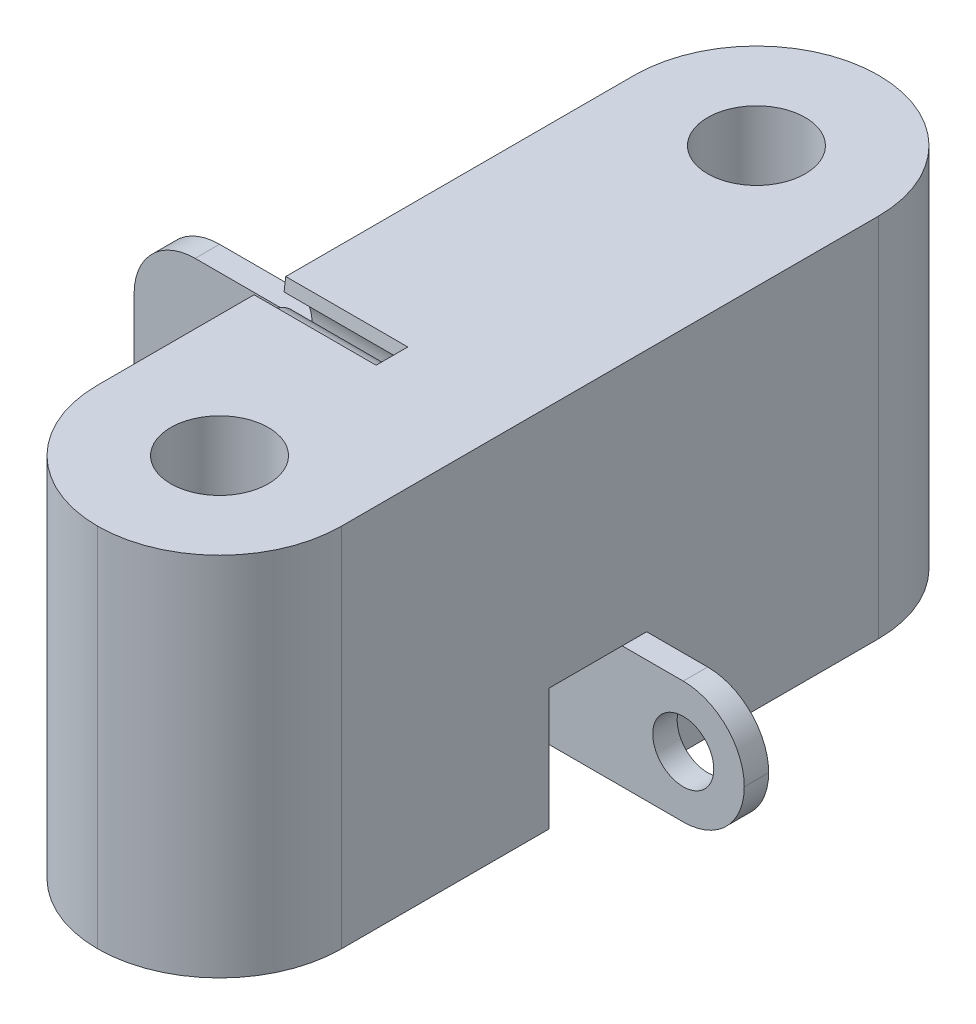
from build123d import *

# Parameters (mm, degrees)
SKETCH2_W                = 20
SKETCH2_H                = 64
BOSS_EXTRUDE1_DEPTH      = 30
SKETCH3_R                = 4
CUT_EXTRUDE1_DEPTH       = 20
SKETCH4_R                = 2.5
CUT_EXTRUDE2_DEPTH       = 10
FILLET1_R                = 10
BOSS_EXTRUDE2_DEPTH      = 20
BOSS_EXTRUDE2_DEPTH_BACK = 30
SKETCH5_W                = 2
SKETCH5_H                = 30
CUT_EXTRUDE3_REACH       = 55.161
SKETCH6_R                = 2.5
SKETCH6_W                = 10
SKETCH6_H                = 20
SKETCH6_W_2              = 20
SKETCH6_H_2              = 10
FILLET2_R                = 5
SKETCH7_W                = 21
SKETCH7_H                = 6
CUT_EXTRUDE4_DEPTH       = 10


with BuildPart() as part:
    # Sketch2 → Boss-Extrude1 (new body)
    with BuildSketch(Plane(origin=(0, 0, 0), x_dir=(1, 0, 0), z_dir=(0, 1, 0))):
        with Locations((6.47761194, -8.23880597)):
            Rectangle(SKETCH2_W, SKETCH2_H)
    extrude(amount=BOSS_EXTRUDE1_DEPTH)

    # Sketch3 → Cut-Extrude1 (cut)
    with BuildSketch(Plane(origin=(0, 30, 0), x_dir=(1, 0, 0), z_dir=(0, 1, 0))):
        with Locations(Location((6.47761194, 13.76119403, 0), (0, 0, 270))):
            Circle(SKETCH3_R)
        with Locations(Location((6.47761194, -30.23880597, 0), (0, 0, 270))):
            Circle(SKETCH3_R)
    extrude(amount=-CUT_EXTRUDE1_DEPTH, mode=Mode.SUBTRACT)

    # Sketch4 → Cut-Extrude2 (cut)
    with BuildSketch(Plane.ZY.offset(3.52238806)):
        with BuildLine():
            Line((17.415034126, 30.126407987), (14.795699792, 30.126407987))
            Line((14.795699792, 30.126407987), (14.949961333, 28.969446425))
            ThreePointArc((14.949961333, 28.969446425), (16.17927412, 22.186618473), (17.347611009, 28.980215007))
            Line((17.347611009, 28.980215007), (17.415034126, 30.126407987))
        make_face()
        with Locations((16.163554702, 25.686583173)):
            Circle(SKETCH4_R, mode=Mode.SUBTRACT)
    extrude(amount=-CUT_EXTRUDE2_DEPTH, mode=Mode.SUBTRACT)

    # Fillet1
    fillet1_edges = [part.edges().sort_by_distance(p)[0] for p in [
        (-3.52238806, 15, -23.76119403),
        (16.47761194, 15, -23.76119403),
        (16.47761194, 15, 40.23880597),
        (-3.52238806, 15, 40.23880597),
    ]]
    fillet(fillet1_edges, radius=FILLET1_R - 0.0001)  # a hair under: the kernel refuses the full size

    # Sketch5 → Boss-Extrude2 (add, two sides: drawn at the far end of the back side and taken through both)
    with BuildSketch(Plane.ZY.offset(3.52238806).offset(-BOSS_EXTRUDE2_DEPTH_BACK)):
        with Locations((6.23880597, 15)):
            Rectangle(SKETCH5_W, SKETCH5_H)
    extrude(amount=BOSS_EXTRUDE2_DEPTH + BOSS_EXTRUDE2_DEPTH_BACK)

    # Sketch6 → Cut-Extrude3 (cut, up to next)
    with BuildSketch(Plane(origin=(0, 0, 5.23880597), x_dir=(-1, 0, 0), z_dir=(0, 0, -1)), mode=Mode.PRIVATE) as cut_extrude3_sk1:
        with Locations((-21.47761194, 5)):
            Circle(SKETCH6_R)
    cut_extrude3_tool1 = extrude(cut_extrude3_sk1.sketch, amount=-CUT_EXTRUDE3_REACH, mode=Mode.PRIVATE) & part.part
    # Sketch6 → Cut-Extrude3 (cut, up to next)
    with BuildSketch(Plane(origin=(0, 0, 5.23880597), x_dir=(-1, 0, 0), z_dir=(0, 0, -1)), mode=Mode.PRIVATE) as cut_extrude3_sk2:
        with Locations((13.52238806, 5)):
            Circle(SKETCH6_R)
    cut_extrude3_tool2 = extrude(cut_extrude3_sk2.sketch, amount=-CUT_EXTRUDE3_REACH, mode=Mode.PRIVATE) & part.part
    # Sketch6 → Cut-Extrude3 (cut, up to next)
    with BuildSketch(Plane(origin=(0, 0, 5.23880597), x_dir=(-1, 0, 0), z_dir=(0, 0, -1)), mode=Mode.PRIVATE) as cut_extrude3_sk3:
        with Locations((-21.47761194, 20)):
            Rectangle(SKETCH6_W, SKETCH6_H)
    cut_extrude3_tool3 = extrude(cut_extrude3_sk3.sketch, amount=-CUT_EXTRUDE3_REACH, mode=Mode.PRIVATE) & part.part
    # Sketch6 → Cut-Extrude3 (cut, up to next)
    with BuildSketch(Plane(origin=(0, 0, 5.23880597), x_dir=(-1, 0, 0), z_dir=(0, 0, -1)), mode=Mode.PRIVATE) as cut_extrude3_sk4:
        with Locations((13.52238806, 25)):
            Rectangle(SKETCH6_W_2, SKETCH6_H_2)
    cut_extrude3_tool4 = extrude(cut_extrude3_sk4.sketch, amount=-CUT_EXTRUDE3_REACH, mode=Mode.PRIVATE) & part.part
    add(cut_extrude3_tool1.solids().sort_by_distance((21.477612, 5, 5.238806))[0], mode=Mode.SUBTRACT)
    add(cut_extrude3_tool2.solids().sort_by_distance((-13.522388, 5, 5.238806))[0], mode=Mode.SUBTRACT)
    add(cut_extrude3_tool3.solids().sort_by_distance((21.477612, 20, 5.238806))[0], mode=Mode.SUBTRACT)
    add(cut_extrude3_tool4.solids().sort_by_distance((-13.522388, 25, 5.238806))[0], mode=Mode.SUBTRACT)

    # Fillet2
    fillet2_edges = [part.edges().sort_by_distance(p)[0] for p in [
        (-23.52238806, 20, 6.23880597),
        (-23.52238806, 0, 6.23880597),
        (26.47761194, 0, 6.23880597),
        (26.47761194, 10, 6.23880597),
    ]]
    fillet(fillet2_edges, radius=FILLET2_R - 0.0001)  # a hair under: the kernel refuses the full size

    # Sketch7 → Cut-Extrude4 (cut)
    with BuildSketch(Plane(origin=(0, 0, 0), x_dir=(-1, 0, 0), z_dir=(0, -1, 0))):
        with Locations((-6.47761194, -10.23880597)):
            Rectangle(SKETCH7_W, SKETCH7_H)
    extrude(amount=-CUT_EXTRUDE4_DEPTH, mode=Mode.SUBTRACT)


solid = part.part
